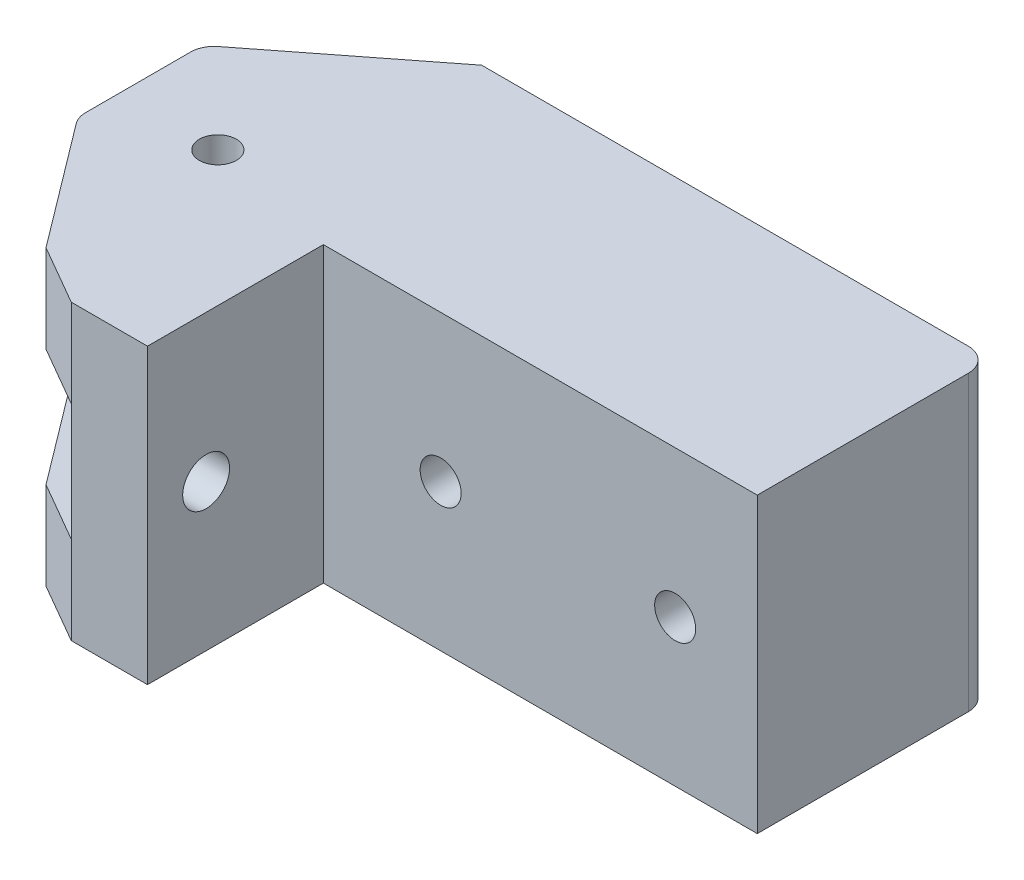
from build123d import *

# Parameters (mm, degrees)
SKETCH1_R               = 1.575
BOSS_EXTRUDE1_DEPTH     = 12.5
SKETCH2_W               = 13.385271969
SKETCH2_H               = 10
CUT_EXTRUDE1_DEPTH      = 68.949865099
SKETCH3_R               = 1.75
CUT_EXTRUDE2_DEPTH      = 25
SKETCH4_R               = 4
CUT_EXTRUDE3_DEPTH      = 4
FILLET1_R               = 2
SKETCH5_R               = 2
CUT_EXTRUDE4_DEPTH      = 10
SKETCH7_R               = 3.575
CUT_EXTRUDE5_DEPTH      = 3.5
CUT_EXTRUDE6_DEPTH      = 5
CUT_EXTRUDE6_DEPTH_BACK = 5
SKETCH8_R               = 10
CUT_EXTRUDE7_DEPTH      = 3


with BuildPart() as part:
    # Sketch1 → Boss-Extrude1 (new, symmetric)
    with BuildSketch(Plane(origin=(0, 0, 0), x_dir=(1, 0, 0), z_dir=(0, 1, 0))):
        Polygon((0, 0), (-43.5, 0), (-56.885271969, -10.457720596), (-56.885271969, -21.057720596), (-48.596177418, -32.057720596), (-43.5, -35), (-37, -35), (-37, -20), (0, -20), align=None)
        with Locations((-48.5, -17.5)):
            Circle(SKETCH1_R, mode=Mode.SUBTRACT)
    extrude(amount=BOSS_EXTRUDE1_DEPTH, both=True)

    # Sketch2 → Cut-Extrude1 (cut, through all)
    with BuildSketch(Plane.XY.offset(35)):
        with Locations((-50.192635985, 0)):
            Rectangle(SKETCH2_W, SKETCH2_H)
    extrude(amount=-CUT_EXTRUDE1_DEPTH, mode=Mode.SUBTRACT)

    # Sketch3 → Cut-Extrude2 (cut)
    with BuildSketch(Plane.XY.offset(20)):
        with Locations((-27, 0)):
            Circle(SKETCH3_R)
        with Locations((-7, 0)):
            Circle(SKETCH3_R)
    extrude(amount=-CUT_EXTRUDE2_DEPTH, mode=Mode.SUBTRACT)

    # Sketch4 → Cut-Extrude3 (cut)
    with BuildSketch(Plane(origin=(0, 0, 0), x_dir=(-1, 0, 0), z_dir=(0, 0, -1))):
        with Locations((7, 0)):
            Circle(SKETCH4_R)
        with Locations((27, 0)):
            Circle(SKETCH4_R)
    extrude(amount=-CUT_EXTRUDE3_DEPTH, mode=Mode.SUBTRACT)

    # Fillet1
    fillet1_edges = [part.edges().sort_by_distance(p)[0] for p in [
        (0, 0, 0),
        (-56.885271969, 8.75, 10.457720596),
        (-56.885271969, 8.75, 21.057720596),
        (-56.885271969, -8.75, 21.057720596),
        (-56.885271969, -8.75, 10.457720596),
    ]]
    fillet(fillet1_edges, radius=FILLET1_R)

    # Sketch5 → Cut-Extrude4 (cut)
    with BuildSketch(Plane.ZY.offset(43.5)):
        with Locations((30, 0)):
            Circle(SKETCH5_R)
    extrude(amount=-CUT_EXTRUDE4_DEPTH, mode=Mode.SUBTRACT)

    # Sketch7 → Cut-Extrude5 (cut)
    with BuildSketch(Plane.ZY.offset(43.5)):
        with Locations((30, 0)):
            Circle(SKETCH7_R)
    extrude(amount=-CUT_EXTRUDE5_DEPTH, mode=Mode.SUBTRACT)

    # Sketch8 → Cut-Extrude6 (cut, two sides: drawn at the far end of the back side and taken through both)
    with BuildSketch(Plane(origin=(0, 0, 0), x_dir=(1, 0, 0), z_dir=(0, 1, 0)).offset(-CUT_EXTRUDE6_DEPTH_BACK)):
        with Locations((-48.5, -17.5)):
            Circle(SKETCH8_R)
    extrude(amount=CUT_EXTRUDE6_DEPTH + CUT_EXTRUDE6_DEPTH_BACK, mode=Mode.SUBTRACT)

    # Sketch9 → Cut-Extrude7 (cut)
    with BuildSketch(Plane.XZ.offset(12.5)):
        Polygon((-46.800589834, 14.481390206), (-45.036102151, 17.462427479), (-46.735512318, 20.481037272), (-50.199410166, 20.518609794), (-51.963897849, 17.537572521), (-50.264487682, 14.518962728), align=None)
    extrude(amount=-CUT_EXTRUDE7_DEPTH, mode=Mode.SUBTRACT)


solid = part.part
